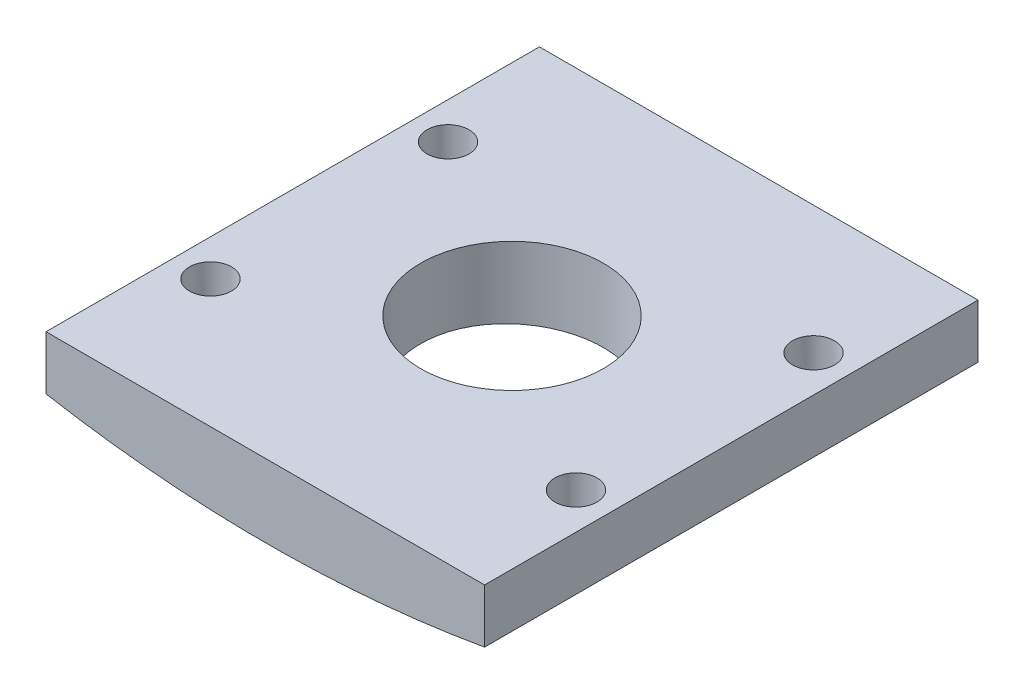
from build123d import *

# Parameters (mm, degrees)
BOSS_EXTRUDE3_DEPTH      = 3
BOSS_EXTRUDE3_DEPTH_BACK = 8
SKETCH4_W                = 24
SKETCH4_H                = 27
SKETCH5_W                = 28.405044576
SKETCH5_H                = 3.736732925
CUT_EXTRUDE1_DEPTH       = 20.371370628
CUT_EXTRUDE1_DEPTH_BACK  = 20.371370628
SKETCH6_R                = 5
SKETCH7_W                = 24
SKETCH7_H                = 27
CUT_EXTRUDE2_DEPTH       = 6
SKETCH8_R                = 1.15
CUT_EXTRUDE3_DEPTH       = 19.500000159
CUT_EXTRUDE4_START       = -2
SKETCH9_R                = 1.9
CUT_EXTRUDE4_DEPTH       = 2


with BuildPart() as part:
    # Sketch4 → Boss-Extrude3 (new, two sides: drawn at the far end of the back side and taken through both)
    with BuildSketch(Plane(origin=(0, 0, 0), x_dir=(1, 0, 0), z_dir=(0, 1, 0)).offset(-BOSS_EXTRUDE3_DEPTH_BACK)):
        Rectangle(SKETCH4_W, SKETCH4_H)
    extrude(amount=BOSS_EXTRUDE3_DEPTH + BOSS_EXTRUDE3_DEPTH_BACK)

    # Sketch5 → Cut-Revolve1 (revolve, cut)
    with BuildSketch(Plane(origin=(0, 0, 0), x_dir=(0, 0, -1), z_dir=(1, 0, 0))):
        with Locations((0.702522288, -8.868366462)):
            Rectangle(SKETCH5_W, SKETCH5_H)
    revolve(axis=Axis((0, 62, 13.5), (0, 0, -1)), mode=Mode.SUBTRACT)

    # Sketch6 → Cut-Extrude1 (cut, two sides: drawn at the far end of the back side and taken through both)
    with BuildSketch(Plane(origin=(0, 0, 0), x_dir=(1, 0, 0), z_dir=(0, 1, 0)).offset(-CUT_EXTRUDE1_DEPTH_BACK)):
        Circle(SKETCH6_R)
    extrude(amount=CUT_EXTRUDE1_DEPTH + CUT_EXTRUDE1_DEPTH_BACK, mode=Mode.SUBTRACT)

    # Sketch7 → Cut-Extrude2 (cut)
    with BuildSketch(Plane(origin=(0, 3, 0), x_dir=(1, 0, 0), z_dir=(0, 1, 0))):
        Rectangle(SKETCH7_W, SKETCH7_H)
    extrude(amount=-CUT_EXTRUDE2_DEPTH, mode=Mode.SUBTRACT)

    # Sketch8 → Cut-Extrude3 (cut, through all)
    with BuildSketch(Plane(origin=(0, -3, 0), x_dir=(1, 0, 0), z_dir=(0, 1, 0))):
        with Locations((-10, 6.5)):
            Circle(SKETCH8_R)
        with Locations((-10, -6.5)):
            Circle(SKETCH8_R)
        with Locations((10, -6.5)):
            Circle(SKETCH8_R)
        with Locations((10, 6.5)):
            Circle(SKETCH8_R)
    extrude(amount=-CUT_EXTRUDE3_DEPTH, mode=Mode.SUBTRACT)

    # Sketch9 → Cut-Extrude4 (cut)
    with BuildSketch(Plane(origin=(0, -3, 0), x_dir=(1, 0, 0), z_dir=(0, 1, 0)).offset(CUT_EXTRUDE4_START)):
        with Locations((-10, 6.5)):
            Circle(SKETCH9_R)
        with Locations((-10, -6.5)):
            Circle(SKETCH9_R)
        with Locations((10, -6.5)):
            Circle(SKETCH9_R)
        with Locations((10, 6.5)):
            Circle(SKETCH9_R)
    extrude(amount=-CUT_EXTRUDE4_DEPTH, mode=Mode.SUBTRACT)


solid = part.part
